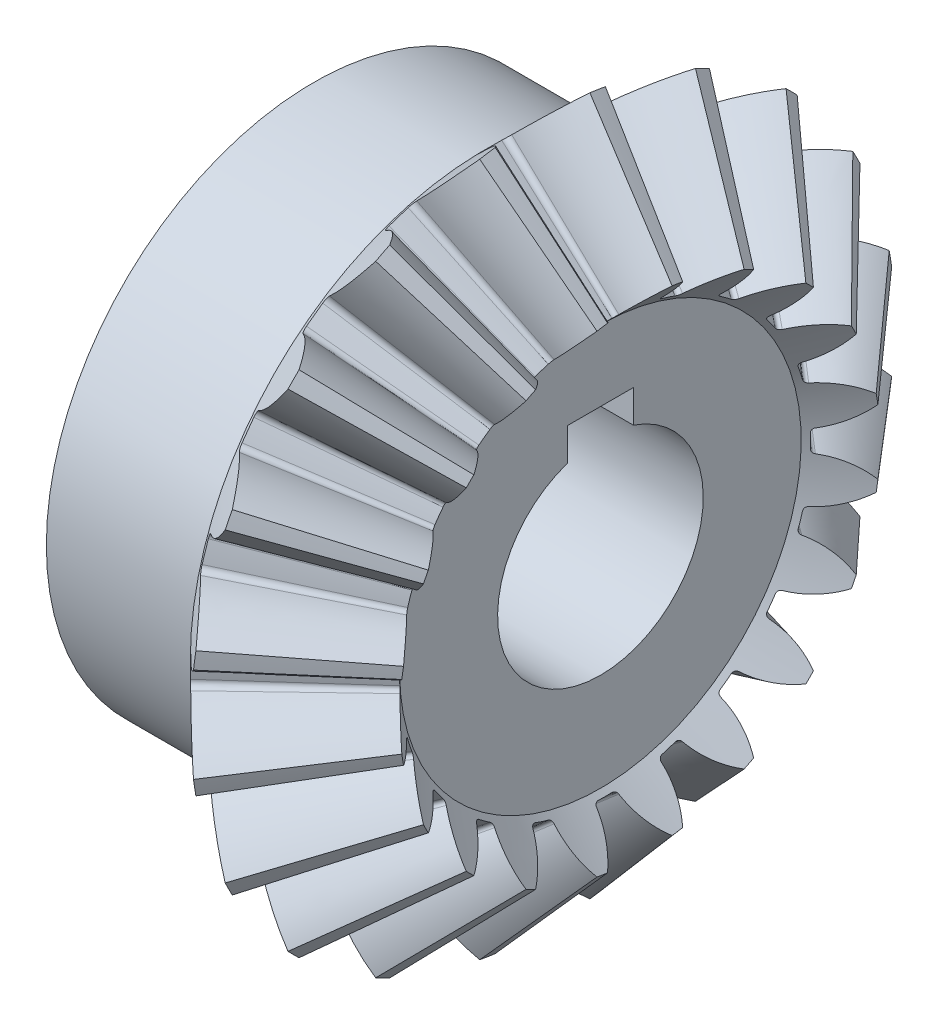
from build123d import *

# Parameters (mm, degrees)
TEETHCUTS_COUNT = 20
TEETHCUTS_ANGLE = 342
HUBSKE_R        = 32.5
HUB_DEPTH       = 20.799003436
BORSKE_R        = 12.5
BORE_DEPTH      = 65.0000508
KEYSKE_W        = 8
KEYSKE_H        = 15.8
KEYWAY_DEPTH    = 65.0000508


with BuildPart() as part:
    # BasProSke → Base-Revolve (revolve)
    with BuildSketch(Plane(origin=(0, 0, 0), x_dir=(1, 0, 0), z_dir=(0, 1, 0)), mode=Mode.PRIVATE) as base_revolve_sk:
        Polygon((0, 0), (0, 35.79890184), (7.029525295, 42.828427122), (18.857447343, 29.200505049), (14.064703302, 24.407761017), (14.064703302, 0), align=None)
    revolve(base_revolve_sk.sketch.rotate(Axis((-10, 0, 0), (1, 0, 0)), 180), axis=Axis((-10, 0, 0), (1, 0, 0)))

    # ToothCut: read off the stored shape, not the designer's step
    # ToothCut: loft between two sections, ruled curve by curve
    toothcut_from = [
        Edge.make_bspline([(44.207145713, 0.006047546, -0.009388477), (44.202916967, 0.0018188, -0.014836366), (44.197225398, -0.003872769, -0.01402633), (44.193849029, -0.007249138, -0.007496068)], [0, 0, 0, 0, 1, 1, 1, 1], 3, [1, 0.77873572, 0.77873572, 1]),
        Edge.make_bspline([(44.193849029, -0.007249138, 0.007496068), (44.197225398, -0.003872769, 0.01402633), (44.202916967, 0.0018188, 0.014836366), (44.207145713, 0.006047546, 0.009388477)], [0, 0, 0, 0, 1, 1, 1, 1], 3, [1, 0.77873572, 0.77873572, 1]),
        Edge.make_bspline([(44.193849029, -0.007249138, -0.007496068), (44.193350411, -0.007747756, -0.006531687), (44.192952305, -0.008145863, -0.005477982), (44.192662572, -0.008435596, -0.004355761)], [0, 0, 0, 0, 1, 1, 1, 1], 3, [1, 0.993417768, 0.993417768, 1]),
        Edge.make_bspline([(44.192662572, -0.008435596, 0.004355761), (44.192952305, -0.008145863, 0.005477982), (44.193350411, -0.007747756, 0.006531687), (44.193849029, -0.007249138, 0.007496068)], [0, 0, 0, 0, 1, 1, 1, 1], 3, [1, 0.993417768, 0.993417768, 1]),
        Edge.make_bspline([(44.192662572, -0.008435596, -0.004355761), (44.191928659, -0.009169509, -0.001513105), (44.191928659, -0.009169509, 0.001513105), (44.192662572, -0.008435596, 0.004355761)], [0, 0, 0, 0, 1, 1, 1, 1], 3, [1, 0.959563429, 0.959563429, 1]),
        Edge.make_line((44.207145713, 0.006047546, 0.009388477), (44.207145713, 0.006047546, -0.009388477)),
    ]
    toothcut_to = [
        Edge.make_bspline([(7.32554149, 43.124443317, -6.418699125), (5.663005764, 41.461907594, -4.077551166), (3.578812717, 39.377714551, -2.553969025), (1.266823435, 37.065725272, -1.989668599)], [0, 0, 0, 0, 1, 1, 1, 1], 3, [1, 0.968995021, 0.968995021, 1]),
        Edge.make_bspline([(1.266823435, 37.065725272, 1.989668599), (3.578812717, 39.377714551, 2.553969025), (5.663005764, 41.461907594, 4.077551166), (7.32554149, 43.124443317, 6.418699125)], [0, 0, 0, 0, 1, 1, 1, 1], 3, [1, 0.968995021, 0.968995021, 1]),
        Edge.make_bspline([(1.266823435, 37.065725272, -1.989668599), (0.991695027, 36.790596865, -1.922516437), (0.815571627, 36.614473465, -1.616147721), (0.825247616, 36.624149454, -1.221542292)], [0, 0, 0, 0, 1, 1, 1, 1], 3, [1, 0.835731877, 0.835731877, 1]),
        Edge.make_bspline([(0.825247616, 36.624149454, 1.221542292), (0.815571627, 36.614473465, 1.616147721), (0.991695027, 36.790596865, 1.922516437), (1.266823435, 37.065725272, 1.989668599)], [0, 0, 0, 0, 1, 1, 1, 1], 3, [1, 0.835731877, 0.835731877, 1]),
        Edge.make_bspline([(0.825247616, 36.624149454, -1.221542292), (0.845212305, 36.644114144, -0.407343897), (0.845212305, 36.644114144, 0.407343897), (0.825247616, 36.624149454, 1.221542292)], [0, 0, 0, 0, 1, 1, 1, 1], 3, [1, 0.999599519, 0.999599519, 1]),
        Edge.make_line((7.32554149, 43.124443317, 6.418699125), (7.32554149, 43.124443317, -6.418699125)),
    ]
    toothcut = Solid(Shell([*[Face.make_surface_from_curves(toothcut_from[k], toothcut_to[k]) for k in range(6)], Face(Wire(toothcut_from)), Face(Wire(toothcut_to))]))
    add(toothcut, mode=Mode.SUBTRACT)

    # TeethCuts: ToothCut ×20 about axis
    teethcuts_axis = Axis((-10, 0, 0), (1, 0, 0))
    for i in range(1, TEETHCUTS_COUNT):
        add(toothcut.rotate(teethcuts_axis, i * TEETHCUTS_ANGLE / (TEETHCUTS_COUNT - 1)), mode=Mode.SUBTRACT)

    # HubSke → Hub (add)
    with BuildSketch(Plane.ZY):
        with Locations(Location((0, 0, 0), (0, 0, 180))):
            Circle(HUBSKE_R)
    extrude(amount=HUB_DEPTH)

    # BorSke → Bore (cut, symmetric)
    with BuildSketch(Plane(origin=(0, 0, 0), x_dir=(0, 0, -1), z_dir=(1, 0, 0))):
        with Locations(Location((0, 0, 0), (0, 0, 180))):
            Circle(BORSKE_R)
    extrude(amount=BORE_DEPTH, both=True, mode=Mode.SUBTRACT)

    # KeySke → Keyway (cut, symmetric)
    with BuildSketch(Plane(origin=(0, 0, 0), x_dir=(0, 0, -1), z_dir=(1, 0, 0))):
        with Locations((0, 7.9)):
            Rectangle(KEYSKE_W, KEYSKE_H)
    extrude(amount=KEYWAY_DEPTH, both=True, mode=Mode.SUBTRACT)


solid = part.part
